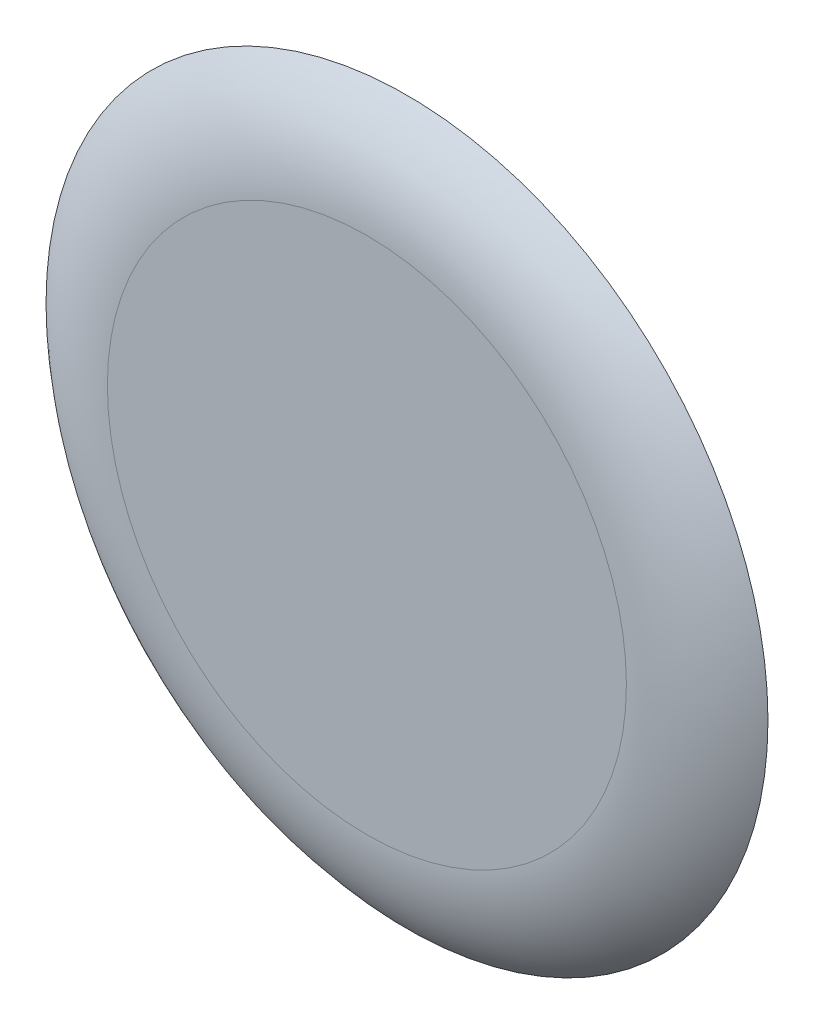
from build123d import *

# Parameters (mm, degrees)
SKETCH1_R           = 4.5
BOSS_EXTRUDE1_DEPTH = 0.5
FILLET2_R           = 1.85


with BuildPart() as part:
    # Sketch1 → Boss-Extrude1 (new body)
    with BuildSketch(Plane.XY):
        Circle(SKETCH1_R)
    extrude(amount=BOSS_EXTRUDE1_DEPTH)

    # Fillet2
    # the kernel refuses this fillet: 1.85 mm, written as the material it takes off along each edge
    with BuildSketch(Plane(origin=(0, 0, 0.5), x_dir=(1, 0, 0), z_dir=(0, -1, 0))) as fillet2_piece_1:
        with BuildLine():
            CenterArc((3.235088936, -1.85), FILLET2_R, 46.863741129, 43.136258871)
            Line((3.235088936, 0), (3.235088936, 0.037))
            Line((3.235088936, 0.037), (4.5, 0.037))
            Line((4.5, 0.037), (4.537, 0))
            ThreePointArc((4.537, 0), (4.537, -0.25), (4.525298221, -0.473))
            Line((4.525298221, -0.473), (4.5, -0.5))
        make_face()
    revolve(axis=Axis((0, 0, 0.5), (0, 0, 1)), mode=Mode.SUBTRACT)


solid = part.part
